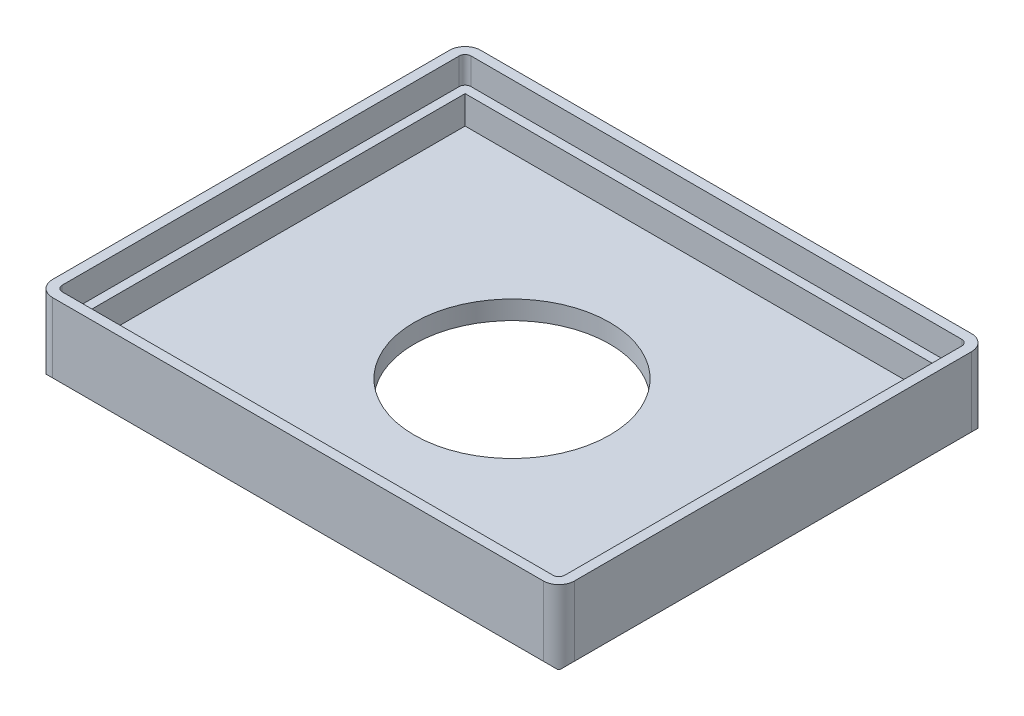
from build123d import *

# Parameters (mm, degrees)
SKETCH1_W           = 66.8
SKETCH1_H           = 54.8
BOSS_EXTRUDE1_DEPTH = 6
CHAMFER2_SIZE       = 0.5
FILLET2_R           = 2
SHELL3_T            = -2.4
BOSS_EXTRUDE4_DEPTH = 3.4
CUT_EXTRUDE2_REACH  = 46.212
SKETCH6_R           = 12.5


with BuildPart() as part:
    # Sketch1 → Boss-Extrude1 (new body)
    with BuildSketch(Plane(origin=(0, 0, 0), x_dir=(1, 0, 0), z_dir=(0, 1, 0))):
        Rectangle(SKETCH1_W, SKETCH1_H)
    extrude(amount=BOSS_EXTRUDE1_DEPTH)

    # Chamfer2
    chamfer2_edges = [part.edges().sort_by_distance(p)[0] for p in [
        (0, 0, 27.4),
        (-33.4, 0, 0),
        (0, 0, -27.4),
        (33.4, 0, 0),
    ]]
    chamfer(chamfer2_edges, length=CHAMFER2_SIZE)

    # Fillet2
    # the kernel refuses this fillet: 2 mm, written as the material it takes off along each edge
    with BuildSketch(Plane(origin=(33.4, -4.5, 27.4), x_dir=(0, 0, -1), z_dir=(0, 1, 0)), Plane(origin=(33.4, -4.5, -27.4), x_dir=(-1, 0, 0), z_dir=(0, 1, 0))) as fillet2_piece_1:
        with BuildLine():
            CenterArc((FILLET2_R, FILLET2_R), FILLET2_R, 180, 90)
            Line((0, FILLET2_R), (0, 0))
            Line((0, 0), (FILLET2_R, 0))
        make_face()
    extrude(amount=15.5, mode=Mode.SUBTRACT)
    with BuildSketch(Plane(origin=(-33.4, -4.5, 27.4), x_dir=(0, 0, -1), z_dir=(0, 1, 0)), Plane(origin=(-33.4, -4.5, -27.4), x_dir=(1, 0, 0), z_dir=(0, 1, 0))) as fillet2_piece_2:
        with BuildLine():
            CenterArc((FILLET2_R, -FILLET2_R), FILLET2_R, 90, 90)
            Line((0, -FILLET2_R), (0, 0))
            Line((0, 0), (FILLET2_R, 0))
        make_face()
    extrude(amount=15.5, mode=Mode.SUBTRACT)

    # Shell3
    shell3_openings = [part.faces().sort_by_distance(p)[0] for p in [
        (0, 6, 0),
    ]]
    offset(amount=SHELL3_T, openings=shell3_openings, kind=Kind.INTERSECTION)

    # Sketch5 → Boss-Extrude4 (add)
    with BuildSketch(Plane(origin=(0, 6, 0), x_dir=(1, 0, 0), z_dir=(0, 1, 0))):
        with BuildLine():
            Line((33.4, -25.4), (33.4, 25.4))
            ThreePointArc((33.4, 25.4), (32.814213562, 26.814213562), (31.4, 27.4))
            Line((31.4, 27.4), (-31.4, 27.4))
            ThreePointArc((-31.4, 27.4), (-32.814213562, 26.814213562), (-33.4, 25.4))
            Line((-33.4, 25.4), (-33.4, -25.4))
            ThreePointArc((-33.4, -25.4), (-32.814213562, -26.814213562), (-31.4, -27.4))
            Line((-31.4, -27.4), (31.4, -27.4))
            ThreePointArc((31.4, -27.4), (32.814213562, -26.814213562), (33.4, -25.4))
        make_face()
        with BuildLine():
            Line((-31.4, -26.15), (31.4, -26.15))
            ThreePointArc((31.4, -26.15), (31.930330086, -25.930330086), (32.15, -25.4))
            Line((32.15, -25.4), (32.15, 25.4))
            ThreePointArc((32.15, 25.4), (31.930330086, 25.930330086), (31.4, 26.15))
            Line((31.4, 26.15), (-31.4, 26.15))
            ThreePointArc((-31.4, 26.15), (-31.930330086, 25.930330086), (-32.15, 25.4))
            Line((-32.15, 25.4), (-32.15, -25.4))
            ThreePointArc((-32.15, -25.4), (-31.930330086, -25.930330086), (-31.4, -26.15))
        make_face(mode=Mode.SUBTRACT)
    extrude(amount=BOSS_EXTRUDE4_DEPTH)

    # Sketch6 → Cut-Extrude2 (cut, up to next)
    with BuildSketch(Plane.XZ, mode=Mode.PRIVATE) as cut_extrude2_sk1:
        with Locations(Location((0, 0, 0), (0, 0, 270))):
            Circle(SKETCH6_R)
    cut_extrude2_tool1 = extrude(cut_extrude2_sk1.sketch, amount=-CUT_EXTRUDE2_REACH, mode=Mode.PRIVATE) & part.part
    add(cut_extrude2_tool1.solids().sort_by_distance((0, 0, 0))[0], mode=Mode.SUBTRACT)


solid = part.part
